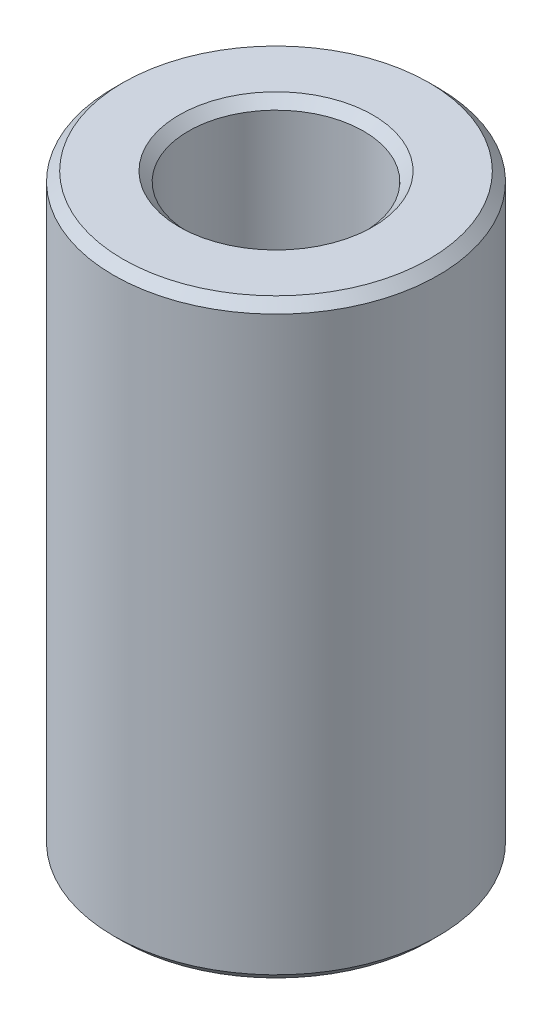
from build123d import *

# Parameters (mm, degrees)
SKETCH1_R           = 15
BOSS_EXTRUDE1_DEPTH = 54.603122063
SKETCH2_R           = 8.097060937
CUT_EXTRUDE1_DEPTH  = 59.579014493
CHAMFER1_SIZE       = 0.860244968


with BuildPart() as part:
    # Sketch1 → Boss-Extrude1 (new body)
    with BuildSketch(Plane(origin=(0, 0, 0), x_dir=(1, 0, 0), z_dir=(0, 1, 0))):
        Circle(SKETCH1_R)
    extrude(amount=BOSS_EXTRUDE1_DEPTH)

    # Sketch2 → Cut-Extrude1 (cut, through all)
    with BuildSketch(Plane(origin=(0, 0, 0), x_dir=(1, 0, 0), z_dir=(0, 1, 0))):
        Circle(SKETCH2_R)
    extrude(amount=CUT_EXTRUDE1_DEPTH, mode=Mode.SUBTRACT)

    # Chamfer1
    chamfer1_edges = [part.edges().sort_by_distance(p)[0] for p in [
        (-8.097060937, 54.603122063, 0),
        (-8.097060937, 0, 0),
        (-15, 0, 0),
        (-15, 54.603122063, 0),
    ]]
    chamfer(chamfer1_edges, length=CHAMFER1_SIZE)


solid = part.part
